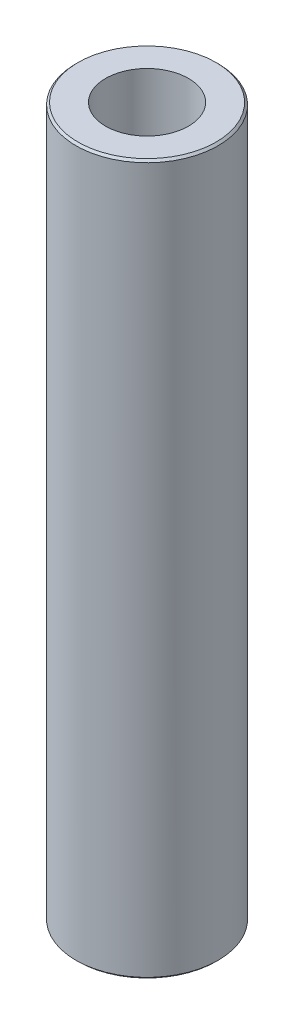
from build123d import *
from OCP.BRepFilletAPI import BRepFilletAPI_MakeChamfer

# Parameters (mm, degrees)
SKETCH1_R           = 27.5
BOSS_EXTRUDE1_DEPTH = 274.511758603
SKETCH2_R           = 16.0296659
CUT_EXTRUDE1_DEPTH  = 278.252963214
CHAMFER1_SIZE       = 0.81666893
CHAMFER1_SIZE2      = 0.805938586


with BuildPart() as part:
    # Sketch1 → Boss-Extrude1 (new body)
    with BuildSketch(Plane(origin=(0, 0, 0), x_dir=(1, 0, 0), z_dir=(0, 1, 0))):
        Circle(SKETCH1_R)
    extrude(amount=BOSS_EXTRUDE1_DEPTH)

    # Sketch2 → Cut-Extrude1 (cut, through all)
    with BuildSketch(Plane(origin=(0, 0, 0), x_dir=(1, 0, 0), z_dir=(0, 1, 0))):
        Circle(SKETCH2_R)
    extrude(amount=CUT_EXTRUDE1_DEPTH, mode=Mode.SUBTRACT)

    # Chamfer1: one chamfer whose edges measure the first distance from different faces: ONE call of the kernel's chamfer builder (chamfer() names one face for all edges)
    chamfer1_edges_1 = [part.edges().sort_by_distance(p)[0] for p in [
        (-27.5, 274.511758603, 0),
    ]]
    chamfer1_side_1 = [part.faces().sort_by_distance(p)[0] for p in [
        (-27.5, 137.255879301, 0),
    ]]
    chamfer1_edges_2 = [part.edges().sort_by_distance(p)[0] for p in [
        (-27.5, 0, 0),
    ]]
    chamfer1_side_2 = [part.faces().sort_by_distance(p)[0] for p in [
        (-26.722182541, 0, 0),
    ]]
    chamfer1 = BRepFilletAPI_MakeChamfer(part.part.solid().wrapped)
    for e in chamfer1_edges_1:
        chamfer1.Add(CHAMFER1_SIZE, CHAMFER1_SIZE2, e.wrapped, chamfer1_side_1[0].wrapped)  # the first distance lies on this face
    for e in chamfer1_edges_2:
        chamfer1.Add(CHAMFER1_SIZE, CHAMFER1_SIZE2, e.wrapped, chamfer1_side_2[0].wrapped)  # the first distance lies on this face
    add(Compound.cast(chamfer1.Shape()), mode=Mode.REPLACE)


solid = part.part
